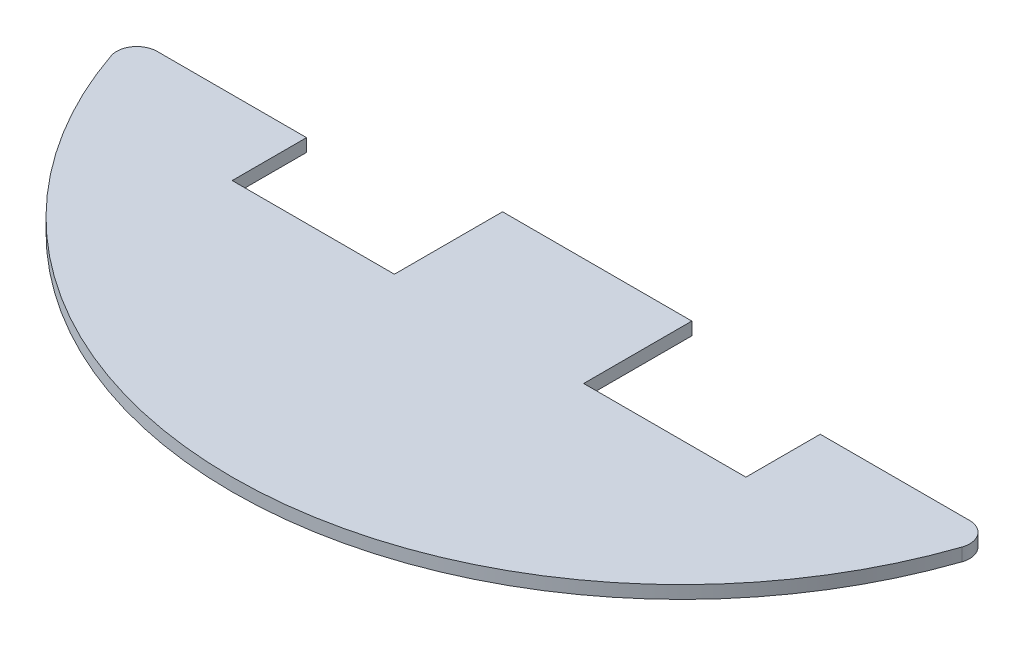
from build123d import *

# Parameters (mm, degrees)
SKETCH1_W           = 36
SKETCH1_H           = 20
BOSS_EXTRUDE1_DEPTH = 1.9
BOSS_EXTRUDE2_DEPTH = 1.9
SKETCH5_W           = 59.232531926
SKETCH5_H           = 32.087665796
CUT_EXTRUDE2_DEPTH  = 10


with BuildPart() as part:
    # Sketch1 → Boss-Extrude1 (new body)
    with BuildSketch(Plane(origin=(0, 0, 0), x_dir=(1, 0, 0), z_dir=(0, 1, 0))):
        Rectangle(SKETCH1_W, SKETCH1_H)
    extrude(amount=BOSS_EXTRUDE1_DEPTH)

    # Sketch5 → Cut-Extrude2 (cut)
    with BuildSketch(Plane(origin=(0, 1.9, 0), x_dir=(1, 0, 0), z_dir=(0, 1, 0))):
        Rectangle(SKETCH5_W, SKETCH5_H)
    extrude(amount=-CUT_EXTRUDE2_DEPTH, mode=Mode.SUBTRACT)


with BuildPart() as body_2:
    # Sketch3 → Boss-Extrude2 (new body)
    with BuildSketch(Plane.XZ):
        with BuildLine():
            Line((-38, 43.574302205), (-38, 54.574302205))
            Line((-38, 54.574302205), (-14, 54.574302205))
            Line((-14, 54.574302205), (-14, 38.574302205))
            Line((-14, 38.574302205), (14, 38.574302205))
            Line((14, 38.574302205), (14, 54.574302205))
            Line((14, 54.574302205), (38, 54.574302205))
            Line((38, 54.574302205), (38, 43.574302205))
            Line((38, 43.574302205), (60.099916805, 43.574302205))
            ThreePointArc((60.099916805, 43.574302205), (62.539743829, 44.828666477), (62.939282954, 47.542806142))
            ThreePointArc((62.939282954, 47.542806142), (0, 92.574302205), (-62.939282954, 47.542806142))
            ThreePointArc((-62.939282954, 47.542806142), (-62.539743829, 44.828666477), (-60.099916805, 43.574302205))
            Line((-60.099916805, 43.574302205), (-38, 43.574302205))
        make_face()
    extrude(amount=-BOSS_EXTRUDE2_DEPTH)


solid = body_2.part
